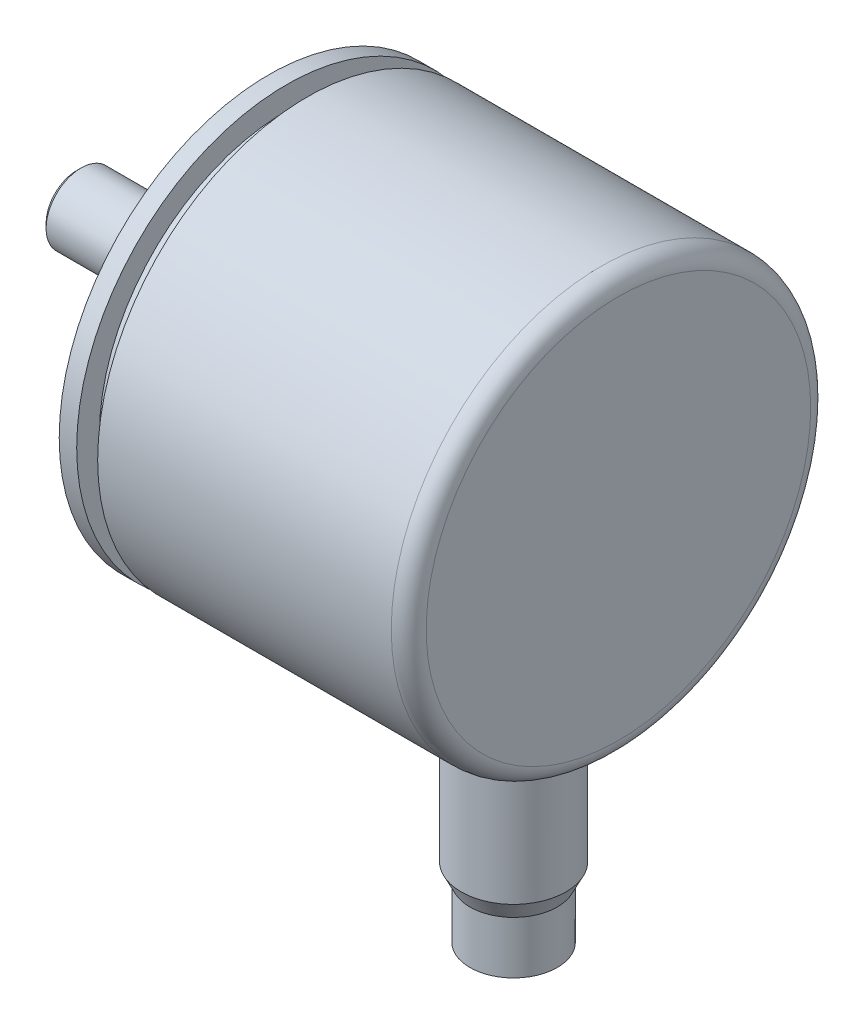
from build123d import *

# Parameters (mm, degrees)
CHAMFER1_SIZE  = 0.25
FILLET1_R      = 1
SKETCH2_R      = 4
EXTRUDE1_DEPTH = 13
SKETCH3_R      = 3
EXTRUDE2_DEPTH = 8
SKETCH4_R      = 2.5
EXTRUDE3_DEPTH = 3
CHAMFER2_SIZE  = 1
CHAMFER3_SIZE2 = 0.5
CHAMFER3_SIZE  = 1
HOLEWZD1_D     = 2.5
HOLEWZD1_DEPTH = 5.5
HOLEWZD1_TIP   = 0.751075774


with BuildPart() as part:
    # Sketch1 → Revolve1 (revolve)
    with BuildSketch(Plane.XY, mode=Mode.PRIVATE) as revolve1_sk:
        Polygon((0, 0), (31, 0), (31, 12), (13.2, 12), (13.2, 10.7), (12, 10.7), (12, 12), (11, 12), (11, 6), (10, 6), (10, 2), (0, 2), align=None)
    revolve(revolve1_sk.sketch.rotate(Axis((0, 0, 0), (-1, 0, 0)), 90), axis=Axis((0, 0, 0), (-1, 0, 0)))

    # Chamfer1
    chamfer1_edges = [part.edges().sort_by_distance(p)[0] for p in [
        (0, 0, 2),
    ]]
    chamfer(chamfer1_edges, length=CHAMFER1_SIZE)

    # Fillet1
    fillet1_edges = [part.edges().sort_by_distance(p)[0] for p in [
        (31, 0, 12),
    ]]
    fillet(fillet1_edges, radius=FILLET1_R)

    # Sketch2 → Extrude1 (add)
    with BuildSketch(Plane(origin=(0, 0, 0), x_dir=(1, 0, 0), z_dir=(0, 1, 0))):
        with Locations(Location((25, 0, 0), (0, 0, 270))):
            Circle(SKETCH2_R)
    extrude(amount=-EXTRUDE1_DEPTH)

    # Sketch3 → Extrude2 (add)
    with BuildSketch(Plane.XZ.offset(13)):
        with Locations(Location((25, 0, 0), (0, 0, 90))):
            Circle(SKETCH3_R)
    extrude(amount=EXTRUDE2_DEPTH)

    # Sketch4 → Extrude3 (add)
    with BuildSketch(Plane.XZ.offset(21)):
        with Locations(Location((25, 0, 0), (0, 0, 270))):
            Circle(SKETCH4_R)
    extrude(amount=EXTRUDE3_DEPTH)

    # Chamfer2
    chamfer2_edges = [part.edges().sort_by_distance(p)[0] for p in [
        (25, -13, -4),
    ]]
    chamfer(chamfer2_edges, length=CHAMFER2_SIZE - 0.0001)  # a hair under: the kernel refuses the full size

    # Chamfer3
    chamfer3_edges = [part.edges().sort_by_distance(p)[0] for p in [
        (25, -21, -3),
    ]]
    chamfer3_side = [part.faces().sort_by_distance(p)[0] for p in [
        (25, -20.99, -3),
    ]]
    chamfer(chamfer3_edges, length=CHAMFER3_SIZE - 0.0001, length2=CHAMFER3_SIZE2 - 0.0001, reference=chamfer3_side[0])  # a hair under: the kernel refuses the full size

    # HoleWzd1
    with Locations(Plane.ZY.offset(-11)):
        with Locations((0, 9), (7.794228634, -4.5), (-7.794228634, -4.5)):
            Hole(HOLEWZD1_D / 2, depth=HOLEWZD1_DEPTH)
            with Locations((0, 0, -(HOLEWZD1_DEPTH + HOLEWZD1_TIP / 2))):  # 118° drill point
                Cone(0, HOLEWZD1_D / 2, HOLEWZD1_TIP, mode=Mode.SUBTRACT)


solid = part.part
